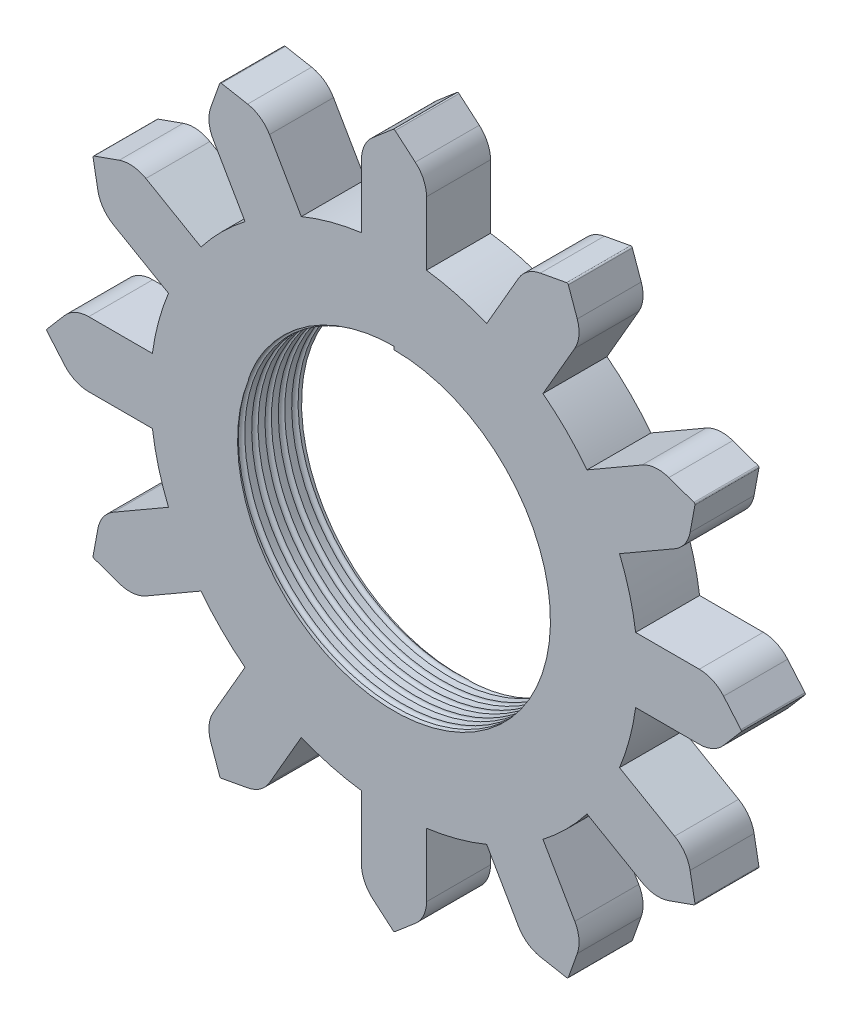
from build123d import *

# Parameters (mm, degrees)
SKETCH1_R           = 9.779
BOSS_EXTRUDE1_DEPTH = 4
CUT_SWEEP8_PITCH    = 0.8333333


with BuildPart() as part:
    # Sketch1 → Boss-Extrude1 (new body)
    with BuildSketch(Plane.XY):
        with BuildLine():
            Line((-0.064931739, 21.684562346), (-1.330634789, 20.603925847))
            ThreePointArc((-1.330634789, 20.603925847), (-1.848214412, 19.920366276), (-2.032, 19.082890777))
            Line((-2.032, 19.082890777), (-2.032, 15.103925847))
            ThreePointArc((-2.032, 15.103925847), (-3.944402247, 14.720709593), (-5.792199303, 14.096383481))
            Line((-5.792199303, 14.096383481), (-7.781681768, 17.542268191))
            ThreePointArc((-7.781681768, 17.542268191), (-8.359582506, 18.175650453), (-9.149599393, 18.508840596))
            Line((-9.149599393, 18.508840596), (-10.786048637, 18.811847731))
            ThreePointArc((-10.786048637, 18.811847731), (-10.854255296, 18.800121652), (-10.898513709, 18.746915992))
            Line((-10.898513709, 18.746915992), (-11.454326454, 17.178205807))
            ThreePointArc((-11.454326454, 17.178205807), (-11.56078377, 16.327436042), (-11.301209009, 15.510268191))
            Line((-11.301209009, 15.510268191), (-9.311726544, 12.064383481))
            ThreePointArc((-9.311726544, 12.064383481), (-10.776307345, 10.776307345), (-12.064383481, 9.311726544))
            Line((-12.064383481, 9.311726544), (-15.510268191, 11.301209009))
            ThreePointArc((-15.510268191, 11.301209009), (-16.327436042, 11.56078377), (-17.178205807, 11.454326454))
            Line((-17.178205807, 11.454326454), (-18.746915992, 10.898513709))
            ThreePointArc((-18.746915992, 10.898513709), (-18.800121652, 10.854255296), (-18.811847731, 10.786048637))
            Line((-18.811847731, 10.786048637), (-18.508840596, 9.149599393))
            ThreePointArc((-18.508840596, 9.149599393), (-18.175650453, 8.359582506), (-17.542268191, 7.781681768))
            Line((-17.542268191, 7.781681768), (-14.096383481, 5.792199303))
            ThreePointArc((-14.096383481, 5.792199303), (-14.720709593, 3.944402247), (-15.103925847, 2.032))
            Line((-15.103925847, 2.032), (-19.082890777, 2.032))
            ThreePointArc((-19.082890777, 2.032), (-19.920366276, 1.848214412), (-20.603925847, 1.330634789))
            Line((-20.603925847, 1.330634789), (-21.684562346, 0.064931739))
            ThreePointArc((-21.684562346, 0.064931739), (-21.708510593, 0), (-21.684562346, -0.064931739))
            Line((-21.684562346, -0.064931739), (-20.603925847, -1.330634789))
            ThreePointArc((-20.603925847, -1.330634789), (-19.920366276, -1.848214412), (-19.082890777, -2.032))
            Line((-19.082890777, -2.032), (-15.103925847, -2.032))
            ThreePointArc((-15.103925847, -2.032), (-14.720709593, -3.944402247), (-14.096383481, -5.792199303))
            Line((-14.096383481, -5.792199303), (-17.542268191, -7.781681768))
            ThreePointArc((-17.542268191, -7.781681768), (-18.175650453, -8.359582506), (-18.508840596, -9.149599393))
            Line((-18.508840596, -9.149599393), (-18.811847731, -10.786048637))
            ThreePointArc((-18.811847731, -10.786048637), (-18.800121652, -10.854255296), (-18.746915992, -10.898513709))
            Line((-18.746915992, -10.898513709), (-17.178205807, -11.454326454))
            ThreePointArc((-17.178205807, -11.454326454), (-16.327436042, -11.56078377), (-15.510268191, -11.301209009))
            Line((-15.510268191, -11.301209009), (-12.064383481, -9.311726544))
            ThreePointArc((-12.064383481, -9.311726544), (-10.776307345, -10.776307345), (-9.311726544, -12.064383481))
            Line((-9.311726544, -12.064383481), (-11.301209009, -15.510268191))
            ThreePointArc((-11.301209009, -15.510268191), (-11.56078377, -16.327436042), (-11.454326454, -17.178205807))
            Line((-11.454326454, -17.178205807), (-10.898513709, -18.746915992))
            ThreePointArc((-10.898513709, -18.746915992), (-10.854255296, -18.800121652), (-10.786048637, -18.811847731))
            Line((-10.786048637, -18.811847731), (-9.149599393, -18.508840596))
            ThreePointArc((-9.149599393, -18.508840596), (-8.359582506, -18.175650453), (-7.781681768, -17.542268191))
            Line((-7.781681768, -17.542268191), (-5.792199303, -14.096383481))
            ThreePointArc((-5.792199303, -14.096383481), (-3.944402247, -14.720709593), (-2.032, -15.103925847))
            Line((-2.032, -15.103925847), (-2.032, -19.082890777))
            ThreePointArc((-2.032, -19.082890777), (-1.848214412, -19.920366276), (-1.330634789, -20.603925847))
            Line((-1.330634789, -20.603925847), (-0.064931739, -21.684562346))
            ThreePointArc((-0.064931739, -21.684562346), (0, -21.708510593), (0.064931739, -21.684562346))
            Line((0.064931739, -21.684562346), (1.330634789, -20.603925847))
            ThreePointArc((1.330634789, -20.603925847), (1.848214412, -19.920366276), (2.032, -19.082890777))
            Line((2.032, -19.082890777), (2.032, -15.103925847))
            ThreePointArc((2.032, -15.103925847), (3.944402247, -14.720709593), (5.792199303, -14.096383481))
            Line((5.792199303, -14.096383481), (7.781681768, -17.542268191))
            ThreePointArc((7.781681768, -17.542268191), (8.359582506, -18.175650453), (9.149599393, -18.508840596))
            Line((9.149599393, -18.508840596), (10.786048637, -18.811847731))
            ThreePointArc((10.786048637, -18.811847731), (10.854255296, -18.800121652), (10.898513709, -18.746915992))
            Line((10.898513709, -18.746915992), (11.454326454, -17.178205807))
            ThreePointArc((11.454326454, -17.178205807), (11.56078377, -16.327436042), (11.301209009, -15.510268191))
            Line((11.301209009, -15.510268191), (9.311726544, -12.064383481))
            ThreePointArc((9.311726544, -12.064383481), (10.776307345, -10.776307345), (12.064383481, -9.311726544))
            Line((12.064383481, -9.311726544), (15.510268191, -11.301209009))
            ThreePointArc((15.510268191, -11.301209009), (16.327436042, -11.56078377), (17.178205807, -11.454326454))
            Line((17.178205807, -11.454326454), (18.746915992, -10.898513709))
            ThreePointArc((18.746915992, -10.898513709), (18.800121652, -10.854255296), (18.811847731, -10.786048637))
            Line((18.811847731, -10.786048637), (18.508840596, -9.149599393))
            ThreePointArc((18.508840596, -9.149599393), (18.175650453, -8.359582506), (17.542268191, -7.781681768))
            Line((17.542268191, -7.781681768), (14.096383481, -5.792199303))
            ThreePointArc((14.096383481, -5.792199303), (14.720709593, -3.944402247), (15.103925847, -2.032))
            Line((15.103925847, -2.032), (19.082890777, -2.032))
            ThreePointArc((19.082890777, -2.032), (19.920366276, -1.848214412), (20.603925847, -1.330634789))
            Line((20.603925847, -1.330634789), (21.684562346, -0.064931739))
            ThreePointArc((21.684562346, -0.064931739), (21.708510593, 0), (21.684562346, 0.064931739))
            Line((21.684562346, 0.064931739), (20.603925847, 1.330634789))
            ThreePointArc((20.603925847, 1.330634789), (19.920366276, 1.848214412), (19.082890777, 2.032))
            Line((19.082890777, 2.032), (15.103925847, 2.032))
            ThreePointArc((15.103925847, 2.032), (14.720709593, 3.944402247), (14.096383481, 5.792199303))
            Line((14.096383481, 5.792199303), (17.542268191, 7.781681768))
            ThreePointArc((17.542268191, 7.781681768), (18.175650453, 8.359582506), (18.508840596, 9.149599393))
            Line((18.508840596, 9.149599393), (18.811847731, 10.786048637))
            ThreePointArc((18.811847731, 10.786048637), (18.800121652, 10.854255296), (18.746915992, 10.898513709))
            Line((18.746915992, 10.898513709), (17.178205807, 11.454326454))
            ThreePointArc((17.178205807, 11.454326454), (16.327436042, 11.56078377), (15.510268191, 11.301209009))
            Line((15.510268191, 11.301209009), (12.064383481, 9.311726544))
            ThreePointArc((12.064383481, 9.311726544), (10.776307345, 10.776307345), (9.311726544, 12.064383481))
            Line((9.311726544, 12.064383481), (11.301209009, 15.510268191))
            ThreePointArc((11.301209009, 15.510268191), (11.56078377, 16.327436042), (11.454326454, 17.178205807))
            Line((11.454326454, 17.178205807), (10.898513709, 18.746915992))
            ThreePointArc((10.898513709, 18.746915992), (10.854255296, 18.800121652), (10.786048637, 18.811847731))
            Line((10.786048637, 18.811847731), (9.149599393, 18.508840596))
            ThreePointArc((9.149599393, 18.508840596), (8.359582506, 18.175650453), (7.781681768, 17.542268191))
            Line((7.781681768, 17.542268191), (5.792199303, 14.096383481))
            ThreePointArc((5.792199303, 14.096383481), (3.944402247, 14.720709593), (2.032, 15.103925847))
            Line((2.032, 15.103925847), (2.032, 19.082890777))
            ThreePointArc((2.032, 19.082890777), (1.848214412, 19.920366276), (1.330634789, 20.603925847))
            Line((1.330634789, 20.603925847), (0.064931739, 21.684562346))
            ThreePointArc((0.064931739, 21.684562346), (0, 21.708510593), (-0.064931739, 21.684562346))
        make_face()
        Circle(SKETCH1_R, mode=Mode.SUBTRACT)
    extrude(amount=BOSS_EXTRUDE1_DEPTH)

    # Cut-Sweep8: arcs per turn and ends read off the stored shape
    # Cut-Sweep8: the profile of Sketch4 screwed along a left-hand helix through 4.75 turns, 8 arcs to a turn; built about Z, then put on its axis
    cut_sweep8_z = Axis((0, 0, 0), (0, 0, 1))
    cut_sweep8_corners = [(9.779, 0, -0.2), (9.579, 0, 0), (9.779, 0, 0.2), (9.979, 0, 0)]
    with BuildLine(mode=Mode.PRIVATE) as cut_sweep8_profile:
        ThreePointArc((9.779, 0, -0.2), (9.637578644, 0, -0.141421356), (9.579, 0, 0))
        ThreePointArc((9.579, 0, 0), (9.637578644, 0, 0.141421356), (9.779, 0, 0.2))
        ThreePointArc((9.779, 0, 0.2), (9.920421356, 0, 0.141421356), (9.979, 0, 0))
        ThreePointArc((9.979, 0, 0), (9.920421356, 0, -0.141421356), (9.779, 0, -0.2))
    cut_sweep8_cap = Face(cut_sweep8_profile.wire())
    cut_sweep8_arcs = [((9.779, 0, -0.2), (9.579, 0, -0.2), (9.579, 0, 0), (1, 0.7071067811865476, 1)), ((9.579, 0, 0), (9.579, 0, 0.2), (9.779, 0, 0.2), (1, 0.7071067811865476, 1)), ((9.779, 0, 0.2), (9.979, 0, 0.2), (9.979, 0, 0), (1, 0.7071067811865476, 1)), ((9.979, 0, 0), (9.979, 0, -0.2), (9.779, 0, -0.2), (1, 0.7071067811865476, 1))]  # start, shoulder, end, weights
    cut_sweep8_turn_angles = [0, -22.5, -45, -67.5, -90, -112.5, -135, -157.5, -180, -202.5, -225, -247.5, -270, -292.5, -315, -337.5, -360]
    cut_sweep8_turn_weights = [1, 0.9238795325112867, 1, 0.9238795325112867, 1, 0.9238795325112867, 1, 0.9238795325112867, 1, 0.9238795325112867, 1, 0.9238795325112867, 1, 0.9238795325112867, 1, 0.9238795325112867, 1]
    cut_sweep8_turn_sides = [Face.make_bezier_surface([[Vector(p[j][0], p[j][1], 0).rotate(cut_sweep8_z, cut_sweep8_turn_angles[2 * i + k]) / cut_sweep8_turn_weights[2 * i + k] + Vector(0, 0, p[j][2] + -CUT_SWEEP8_PITCH * cut_sweep8_turn_angles[2 * i + k] / 360) for k in range(3)] for j in range(3)], [[p[3][j] * cut_sweep8_turn_weights[2 * i + k] for k in range(3)] for j in range(3)]) for p in cut_sweep8_arcs for i in range(8)]
    cut_sweep8_last_angles = [-1440, -1462.5, -1485, -1507.5, -1530, -1552.5, -1575, -1597.5, -1620, -1642.5, -1665, -1687.5, -1710]
    cut_sweep8_last_weights = [1, 0.9238795325112867, 1, 0.9238795325112867, 1, 0.9238795325112867, 1, 0.9238795325112867, 1, 0.9238795325112867, 1, 0.9238795325112814, 1]
    cut_sweep8_last_sides = [Face.make_bezier_surface([[Vector(p[j][0], p[j][1], 0).rotate(cut_sweep8_z, cut_sweep8_last_angles[2 * i + k]) / cut_sweep8_last_weights[2 * i + k] + Vector(0, 0, p[j][2] + -CUT_SWEEP8_PITCH * cut_sweep8_last_angles[2 * i + k] / 360) for k in range(3)] for j in range(3)], [[p[3][j] * cut_sweep8_last_weights[2 * i + k] for k in range(3)] for j in range(3)]) for p in cut_sweep8_arcs for i in range(6)]
    cut_sweep8 = Plane(origin=(0, 0, 0), x_dir=(1, 0, 0), z_dir=(0, 0, 1)) * Solid(Shell([*[p.moved(Location((0, 0, CUT_SWEEP8_PITCH * i))) for i in range(4) for p in cut_sweep8_turn_sides], *cut_sweep8_last_sides, cut_sweep8_cap, cut_sweep8_cap.rotate(cut_sweep8_z, -1710).moved(Location((0, 0, -CUT_SWEEP8_PITCH * -1710 / 360)))]))
    add(cut_sweep8, mode=Mode.SUBTRACT)


solid = part.part
